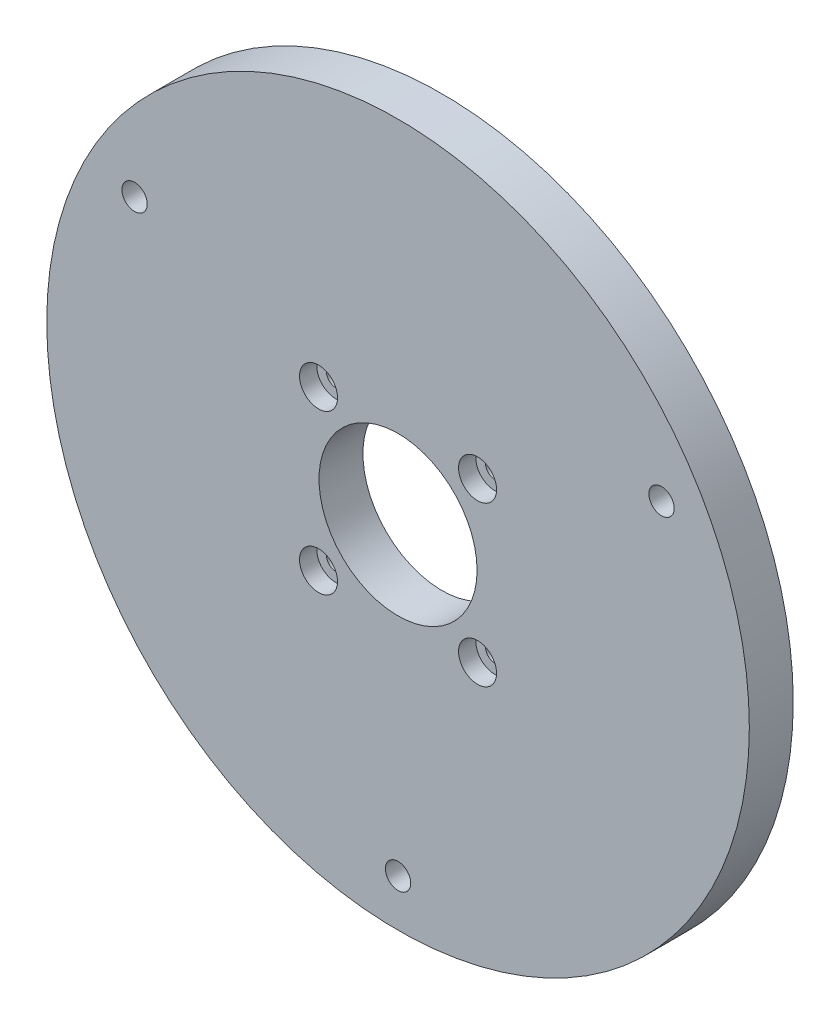
from build123d import *

# Parameters (mm, degrees)
SKETCH1_R                        = 50.8
BOSS_EXTRUDE1_DEPTH              = 6.35
SKETCH2_R                        = 11.43
CUT_EXTRUDE1_DEPTH               = 73.122135992
CBORE_FOR_M2_5_SHCS1_D           = 2.7
CBORE_FOR_M2_5_SHCS1_DEPTH       = 10.16
CBORE_FOR_M2_5_SHCS1_CBORE_D     = 5.5
CBORE_FOR_M2_5_SHCS1_CBORE_DEPTH = 2.5
CBORE_FOR_M2_5_SHCS1_TIP         = 0.811161836
F_6_CLEARANCE_HOLE1_D            = 3.6576
F_6_CLEARANCE_HOLE1_DEPTH        = 10.16
F_6_CLEARANCE_HOLE1_TIP          = 1.0988539


with BuildPart() as part:
    # Sketch1 → Boss-Extrude1 (new body)
    with BuildSketch(Plane.XY):
        Circle(SKETCH1_R)
    extrude(amount=BOSS_EXTRUDE1_DEPTH)

    # Sketch2 → Cut-Extrude1 (cut, through all)
    with BuildSketch(Plane.XY.offset(6.35)):
        Circle(SKETCH2_R)
    extrude(amount=-CUT_EXTRUDE1_DEPTH, mode=Mode.SUBTRACT)

    # CBORE for M2.5 SHCS1
    with Locations(Plane.XY.offset(6.35)):
        with Locations((0, 0), (11.5, 11.5), (-11.5, -11.5), (-11.5, 11.5), (11.5, -11.5)):
            CounterBoreHole(CBORE_FOR_M2_5_SHCS1_D / 2, CBORE_FOR_M2_5_SHCS1_CBORE_D / 2, CBORE_FOR_M2_5_SHCS1_CBORE_DEPTH, depth=CBORE_FOR_M2_5_SHCS1_DEPTH)
            with Locations((0, 0, -(CBORE_FOR_M2_5_SHCS1_DEPTH + CBORE_FOR_M2_5_SHCS1_TIP / 2))):  # 118° drill point
                Cone(0, CBORE_FOR_M2_5_SHCS1_D / 2, CBORE_FOR_M2_5_SHCS1_TIP, mode=Mode.SUBTRACT)

    # #6 Clearance Hole1
    with Locations(Plane.XY.offset(6.35)):
        with Locations((-38.1, 21.997045256), (0, -43.994090512), (38.1, 21.997045256)):
            Hole(F_6_CLEARANCE_HOLE1_D / 2, depth=F_6_CLEARANCE_HOLE1_DEPTH)
            with Locations((0, 0, -(F_6_CLEARANCE_HOLE1_DEPTH + F_6_CLEARANCE_HOLE1_TIP / 2))):  # 118° drill point
                Cone(0, F_6_CLEARANCE_HOLE1_D / 2, F_6_CLEARANCE_HOLE1_TIP, mode=Mode.SUBTRACT)


solid = part.part
